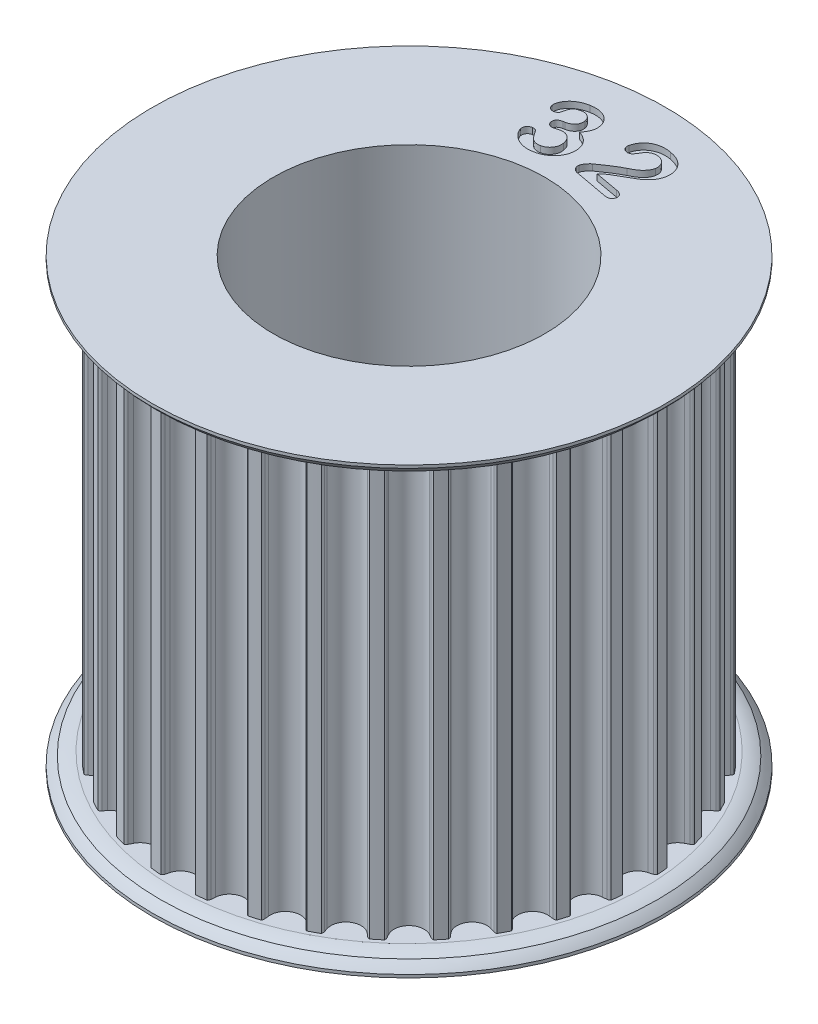
from build123d import *

# Parameters (mm, degrees)
SKETCH1_R                    = 14.897875026
TOOTHOD_DEPTH                = 13.335
TOOTHPROFILE_DEPTH           = 25.934225185
TOOTHPATTERN_COUNT           = 32
BORE_DEPTH                   = 28.373214211
BORE_DEPTH_BACK              = 28.373214211
SKETCH7_R                    = 8.73125
LARGE_TOOTH_COUNT_DEPTH      = 37.901095173
LARGE_TOOTH_COUNT_DEPTH_BACK = 0.4
SKETCH14_W                   = 12.7
SKETCH14_H                   = 2.8829


with BuildPart() as part:
    # Sketch1 → ToothOD (new, symmetric)
    with BuildSketch(Plane(origin=(0, 0, 0), x_dir=(1, 0, 0), z_dir=(0, 1, 0))):
        Circle(SKETCH1_R)
    extrude(amount=TOOTHOD_DEPTH, both=True)

    # Sketch2 → ToothProfile (cut, symmetric)
    with BuildSketch(Plane(origin=(0, 0, 0), x_dir=(1, 0, 0), z_dir=(0, 1, 0))):
        with BuildLine():
            ThreePointArc((-0.937033068, 14.447937022), (-0.590385173, 13.929762412), (0, 13.729475026))
            ThreePointArc((0, 13.729475026), (0.590385173, 13.929762412), (0.937033068, 14.447937022))
            ThreePointArc((0.937033068, 14.447937022), (0.971699064, 14.574048484), (1.007805813, 14.699755026))
            ThreePointArc((1.007805813, 14.699755026), (1.049505061, 14.78673532), (1.11667299, 14.855965863))
            ThreePointArc((1.11667299, 14.855965863), (0, 14.897875026), (-1.11667299, 14.855965863))
            ThreePointArc((-1.11667299, 14.855965863), (-1.049505061, 14.78673532), (-1.007805813, 14.699755026))
            ThreePointArc((-1.007805813, 14.699755026), (-0.971699064, 14.574048484), (-0.937033068, 14.447937022))
        make_face()
    toothprofile = extrude(amount=TOOTHPROFILE_DEPTH, both=True, mode=Mode.SUBTRACT)

    # ToothPattern: ToothProfile ×32 about axis
    toothpattern_axis = Axis((0, 13.335, 0), (0, -1, 0))
    for i in range(1, TOOTHPATTERN_COUNT):
        add(toothprofile.rotate(toothpattern_axis, i * 360 / TOOTHPATTERN_COUNT), mode=Mode.SUBTRACT)

    # Sketch4 → Flange (revolve)
    with BuildSketch(Plane.XY):
        with BuildLine():
            Line((0, -13.335), (15.151875026, -13.335))
            ThreePointArc((15.151875026, -13.335), (15.588054604, -13.424791667), (16.002, -13.589))
            ThreePointArc((16.002, -13.589), (16.270284982, -13.828715018), (16.51, -14.097))
            Line((16.51, -14.097), (16.51, -14.2875))
            Line((16.51, -14.2875), (0, -14.2875))
            Line((0, -14.2875), (0, -13.335))
        make_face()
        with BuildLine():
            Line((16.51, 14.2875), (16.51, 14.097))
            ThreePointArc((16.51, 14.097), (16.270284982, 13.828715018), (16.002, 13.589))
            ThreePointArc((16.002, 13.589), (15.588054604, 13.424791667), (15.151875026, 13.335))
            Line((15.151875026, 13.335), (0, 13.335))
            Line((0, 13.335), (0, 14.2875))
            Line((0, 14.2875), (16.51, 14.2875))
        make_face()
    revolve(axis=Axis((0, 8.73125, 0), (0, -1, 0)))

    # Sketch7 → Bore (cut, two sides: drawn at the far end of the back side and taken through both)
    with BuildSketch(Plane.XZ.offset(-BORE_DEPTH_BACK)):
        Circle(SKETCH7_R)
    extrude(amount=BORE_DEPTH + BORE_DEPTH_BACK, mode=Mode.SUBTRACT)

    # Sketch9 → Large Tooth Count (cut, two sides: drawn at the far end of the back side and taken through both)
    with BuildSketch(Plane(origin=(0, 14.2875, 0), x_dir=(1, 0, 0), z_dir=(0, 1, 0)).offset(-LARGE_TOOTH_COUNT_DEPTH_BACK)):
        with BuildLine():
            add(Edge.make_bspline(
                [(-2.395395166, 12.44030561), (-2.351764935, 12.449788273), (-2.26636482, 12.468349267), (-2.148342517, 12.521687794), (-2.042804555, 12.591006059), (-1.96740896, 12.663473497), (-1.915871931, 12.728738206), (-1.883660529, 12.781439315), (-1.858242003, 12.837454575), (-1.840411306, 12.896637263), (-1.829894588, 12.959037271), (-1.825356933, 13.024243133), (-1.828016507, 13.092828085), (-1.835316428, 13.138960651), (-1.839075635, 13.162717329)],
                knots=[0, 0, 0, 0, 1.56408417, 3.061477405, 4.516692484, 5.980328475, 6.71001621, 7.432406507, 8.143441474, 8.864242186, 9.596246751, 10.361021371, 11.155982632, 12, 12, 12, 12], degree=3))
            add(Edge.make_bspline(
                [(-1.839075635, 13.162717329), (-1.847468614, 13.198321462), (-1.863918276, 13.268103117), (-1.912945679, 13.363762957), (-1.979770738, 13.4477246), (-2.063508364, 13.518748482), (-2.161688264, 13.573950381), (-2.272366388, 13.606154076), (-2.39306776, 13.616531188), (-2.474963903, 13.604676737), (-2.517731885, 13.598486079)],
                knots=[0, 0, 0, 0, 0.970242947, 1.901609501, 2.831594879, 3.809017159, 4.805027202, 5.804681963, 6.853556249, 8, 8, 8, 8], degree=3))
            add(Edge.make_bspline(
                [(-2.517731885, 13.598486079), (-2.546415601, 13.592694971), (-2.601323677, 13.581609287), (-2.678208847, 13.55850786), (-2.746350603, 13.530836409), (-2.805384858, 13.497992457), (-2.855844248, 13.460479936), (-2.900373354, 13.421487835), (-2.937064484, 13.378096327), (-2.978986878, 13.315102944), (-3.020518734, 13.221832551), (-3.059478235, 13.098283973), (-3.093381877, 12.968046045), (-3.114639047, 12.880861708), (-3.124950635, 12.838569673)],
                knots=[0, 0, 0, 0, 0.994372717, 1.903487376, 2.72466848, 3.490292993, 4.192582868, 4.858964158, 5.497730828, 6.117954991, 7.426137334, 8.949273991, 10.520130824, 12, 12, 12, 12], degree=3))
            add(Edge.make_bspline(
                [(-3.124950635, 12.838569673), (-3.129102288, 12.828888525), (-3.137555782, 12.809176013), (-3.156946896, 12.781271911), (-3.184316211, 12.757087617), (-3.228365663, 12.724989234), (-3.296869514, 12.693279737), (-3.356792915, 12.679657358), (-3.388376416, 12.672477485)],
                knots=[0, 0, 0, 0, 0.583215557, 1.187529019, 1.864732099, 2.597558886, 4.206693834, 6, 6, 6, 6], degree=3))
            add(Edge.make_bspline(
                [(-3.388376416, 12.672477485), (-3.408006408, 12.670159859), (-3.447059185, 12.665549071), (-3.507022694, 12.67355228), (-3.566425146, 12.693523488), (-3.623655514, 12.725811297), (-3.677136394, 12.767570228), (-3.718303855, 12.823277744), (-3.750834042, 12.887407726), (-3.76148388, 12.935253341), (-3.766995166, 12.960013423)],
                knots=[0, 0, 0, 0, 0.895545026, 1.78163704, 2.722927117, 3.728259503, 4.757347425, 5.780279766, 6.851295854, 8, 8, 8, 8], degree=3))
            add(Edge.make_bspline(
                [(-3.766995166, 12.960013423), (-3.770411448, 12.985862618), (-3.777384046, 13.038620566), (-3.773919219, 13.121047331), (-3.759263587, 13.207335205), (-3.733005125, 13.296987906), (-3.696578666, 13.389099655), (-3.647932397, 13.480993304), (-3.588113382, 13.572735702), (-3.518084365, 13.664428947), (-3.436036471, 13.753650839), (-3.341843972, 13.838087605), (-3.234599648, 13.915677391), (-3.115927699, 13.987966339), (-2.986130398, 14.052791424), (-2.845920922, 14.108605922), (-2.695743201, 14.153101315), (-2.591436102, 14.174340706), (-2.538270166, 14.185166548)],
                knots=[0, 0, 0, 0, 0.657648442, 1.342253878, 2.074039585, 2.864148476, 3.697712609, 4.572156031, 5.485651204, 6.461680898, 7.483386968, 8.543039874, 9.651430748, 10.822328438, 12.049685541, 13.311901225, 14.629860395, 16, 16, 16, 16], degree=3))
            add(Edge.make_bspline(
                [(-2.538270166, 14.185166548), (-2.491323817, 14.192598445), (-2.399252753, 14.207173862), (-2.262542202, 14.218659249), (-2.130523977, 14.21615243), (-2.003510296, 14.205171913), (-1.88150585, 14.182798989), (-1.765492151, 14.149880101), (-1.655706619, 14.106812961), (-1.552939002, 14.053959346), (-1.457386459, 13.992879421), (-1.37142964, 13.922784448), (-1.294282136, 13.845573559), (-1.228614102, 13.759473777), (-1.172184525, 13.667230001), (-1.12544845, 13.569517), (-1.089148427, 13.465869789), (-1.073635459, 13.393899723), (-1.065764698, 13.357384517)],
                knots=[0, 0, 0, 0, 1.205963252, 2.365132143, 3.475536425, 4.552557823, 5.596986774, 6.617881568, 7.608112011, 8.584359298, 9.54600503, 10.480268389, 11.393565618, 12.30907766, 13.221030907, 14.133203077, 15.052849641, 16, 16, 16, 16], degree=3))
            add(Edge.make_bspline(
                [(-1.065764698, 13.357384517), (-1.058444517, 13.309874096), (-1.044223716, 13.217576343), (-1.046060272, 13.080838704), (-1.062999475, 12.95140843), (-1.100190083, 12.829006806), (-1.152753369, 12.710344301), (-1.218197892, 12.591451706), (-1.297956271, 12.471597027), (-1.359266437, 12.394328645), (-1.390805323, 12.35458061)],
                knots=[0, 0, 0, 0, 1.053632123, 2.04687467, 2.990381272, 3.91042597, 4.843946409, 5.835317206, 6.886454128, 8, 8, 8, 8], degree=3))
            add(Edge.make_bspline(
                [(-1.390805323, 12.35458061), (-1.350412041, 12.340545314), (-1.270980886, 12.312945681), (-1.157752588, 12.262979632), (-1.052586502, 12.206626181), (-0.956144809, 12.143795096), (-0.867013097, 12.07655175), (-0.788401054, 12.001417094), (-0.716721652, 11.921931915), (-0.655517404, 11.83490394), (-0.602231291, 11.742811281), (-0.559592513, 11.644667954), (-0.524881708, 11.541361692), (-0.509910371, 11.46953943), (-0.502301416, 11.43303686)],
                knots=[0, 0, 0, 0, 1.139891914, 2.24153439, 3.296229475, 4.31773043, 5.308329865, 6.268443975, 7.212979858, 8.157782482, 9.099914282, 10.045216846, 11.006511264, 12, 12, 12, 12], degree=3))
            add(Edge.make_bspline(
                [(-0.502301416, 11.43303686), (-0.495319451, 11.388490119), (-0.481414307, 11.299771707), (-0.478916202, 11.164667165), (-0.488260491, 11.029415833), (-0.51276627, 10.894860542), (-0.549846959, 10.762327063), (-0.602249742, 10.634138329), (-0.667869204, 10.510393731), (-0.746222597, 10.391484268), (-0.838347041, 10.280067973), (-0.942787724, 10.17663575), (-1.059215889, 10.081986318), (-1.186989884, 9.996266633), (-1.325681923, 9.920701304), (-1.475651654, 9.858916788), (-1.635068246, 9.806633217), (-1.746512528, 9.78436586), (-1.803356885, 9.773007954)],
                knots=[0, 0, 0, 0, 0.919196757, 1.830654129, 2.750292315, 3.682047259, 4.616530511, 5.553871909, 6.502170786, 7.470871317, 8.454707972, 9.446890999, 10.465768377, 11.511964047, 12.582837701, 13.682741819, 14.818036711, 16, 16, 16, 16], degree=3))
            add(Edge.make_bspline(
                [(-1.803356885, 9.773007954), (-1.861273881, 9.764095157), (-1.97457734, 9.746658985), (-2.143413115, 9.740832432), (-2.305966452, 9.751048954), (-2.461225746, 9.778889999), (-2.606979598, 9.821119725), (-2.742928406, 9.873090337), (-2.868308727, 9.934276457), (-2.981900004, 10.005903776), (-3.083286845, 10.085279788), (-3.175837052, 10.166704637), (-3.256567319, 10.253286516), (-3.326556915, 10.341337364), (-3.383639504, 10.428572924), (-3.428783069, 10.510279282), (-3.462785872, 10.585170072), (-3.474766814, 10.634802087), (-3.480352198, 10.657939985)],
                knots=[0, 0, 0, 0, 1.358988971, 2.658600414, 3.911700577, 5.132627013, 6.311151581, 7.428568411, 8.506776026, 9.543649576, 10.538503265, 11.492538343, 12.401569204, 13.281931069, 14.10006001, 14.817332809, 15.448653585, 16, 16, 16, 16], degree=3))
            add(Edge.make_bspline(
                [(-3.480352198, 10.657939985), (-3.483746984, 10.68497257), (-3.490277506, 10.736974917), (-3.483346924, 10.814189742), (-3.459407148, 10.885488216), (-3.420429227, 10.949801807), (-3.370073369, 11.006058136), (-3.308307685, 11.050542415), (-3.238271172, 11.084475844), (-3.186891971, 11.095909843), (-3.160669385, 11.101745454)],
                knots=[0, 0, 0, 0, 1.065165672, 2.049049875, 3.00773798, 3.985592617, 4.976224793, 5.944087156, 6.950716419, 8, 8, 8, 8], degree=3))
            add(Edge.make_bspline(
                [(-3.160669385, 11.101745454), (-3.132597094, 11.104682386), (-3.07565053, 11.110640153), (-3.005449066, 11.091014031), (-2.953679925, 11.068571016), (-2.91939304, 11.047595496), (-2.891337116, 11.023070197), (-2.877833025, 11.003226451), (-2.87134751, 10.993696235)],
                knots=[0, 0, 0, 0, 1.550673656, 3.145647615, 3.957272918, 4.675311549, 5.363801208, 6, 6, 6, 6], degree=3))
            add(Edge.make_bspline(
                [(-2.87134751, 10.993696235), (-2.834765451, 10.934439869), (-2.765769991, 10.822679615), (-2.654254449, 10.673931939), (-2.546873402, 10.549804547), (-2.454600564, 10.465849729), (-2.379391167, 10.412984746), (-2.320630434, 10.38270277), (-2.259082437, 10.358414541), (-2.19377006, 10.341195919), (-2.12514281, 10.331648111), (-2.053345183, 10.329022341), (-1.978350806, 10.333749213), (-1.927728345, 10.341432664), (-1.901583448, 10.345400923)],
                knots=[0, 0, 0, 0, 1.989651524, 3.75257504, 5.30775678, 6.675689646, 7.305821198, 7.929950262, 8.560368956, 9.193937615, 9.855728221, 10.536870827, 11.244340126, 12, 12, 12, 12], degree=3))
            add(Edge.make_bspline(
                [(-1.901583448, 10.345400923), (-1.871644399, 10.352199583), (-1.811653801, 10.36582245), (-1.724531025, 10.397969414), (-1.641916359, 10.442636299), (-1.563158271, 10.496780316), (-1.491100009, 10.561890428), (-1.427079449, 10.636365346), (-1.373201458, 10.72071369), (-1.328532708, 10.813025229), (-1.296080307, 10.912955075), (-1.279366413, 11.018302819), (-1.277092498, 11.127852865), (-1.287926429, 11.200953457), (-1.293471729, 11.238369673)],
                knots=[0, 0, 0, 0, 0.918783497, 1.841019456, 2.770121856, 3.724533536, 4.696473957, 5.670047891, 6.656552307, 7.685126467, 8.733743146, 9.79028542, 10.868967352, 12, 12, 12, 12], degree=3))
            add(Edge.make_bspline(
                [(-1.293471729, 11.238369673), (-1.298936686, 11.265876176), (-1.30961674, 11.319631579), (-1.333478309, 11.396401406), (-1.360287624, 11.468479114), (-1.394965812, 11.533732243), (-1.433076599, 11.593785038), (-1.476357011, 11.648422925), (-1.525805682, 11.69629192), (-1.579318811, 11.739547501), (-1.637253652, 11.775881164), (-1.698731759, 11.806115638), (-1.76434029, 11.827990482), (-1.83303783, 11.844288015), (-1.905487999, 11.853175874), (-1.98114044, 11.854782163), (-2.060573072, 11.849194939), (-2.114159971, 11.840923764), (-2.141792041, 11.836658735)],
                knots=[0, 0, 0, 0, 1.142167213, 2.232114242, 3.272952444, 4.271354239, 5.237162538, 6.16931723, 7.104388237, 8.036542928, 8.968855492, 9.885808178, 10.82190168, 11.781211808, 12.759285311, 13.790748962, 14.860800298, 16, 16, 16, 16], degree=3))
            add(Edge.make_bspline(
                [(-2.141792041, 11.836658735), (-2.152794304, 11.834231238), (-2.177762529, 11.828722342), (-2.219583134, 11.820746399), (-2.268450918, 11.806036359), (-2.322602613, 11.792515486), (-2.374969303, 11.777315582), (-2.420194021, 11.766479519), (-2.454197188, 11.756940782), (-2.473367184, 11.752663579), (-2.481120166, 11.750933735)],
                knots=[0, 0, 0, 0, 0.772488785, 1.753064323, 2.916415325, 4.267721891, 5.579625089, 6.653636691, 7.455485957, 8, 8, 8, 8], degree=3))
            add(Edge.make_bspline(
                [(-2.481120166, 11.750933735), (-2.506960456, 11.746913438), (-2.556158075, 11.739259148), (-2.627480161, 11.7445519), (-2.692385424, 11.758886393), (-2.748894318, 11.788116673), (-2.797532533, 11.827971419), (-2.835684342, 11.879578873), (-2.863495022, 11.941556302), (-2.873931957, 11.987031385), (-2.879384229, 12.010787642)],
                knots=[0, 0, 0, 0, 1.158395447, 2.205482207, 3.158342672, 4.093034092, 5.004217035, 5.930162721, 6.91871368, 8, 8, 8, 8], degree=3))
            add(Edge.make_bspline(
                [(-2.879384229, 12.010787642), (-2.882631581, 12.034581517), (-2.888938576, 12.080793902), (-2.878805561, 12.149340934), (-2.856720158, 12.213565122), (-2.817758689, 12.271771874), (-2.764205594, 12.323365118), (-2.69486753, 12.365228304), (-2.61067647, 12.39742537), (-2.548927529, 12.410824563), (-2.515945948, 12.417981392)],
                knots=[0, 0, 0, 0, 0.930670598, 1.807545321, 2.668967297, 3.556120476, 4.506850782, 5.542439393, 6.687358266, 8, 8, 8, 8], degree=3))
            Line((-2.515945948, 12.417981392), (-2.395395166, 12.44030561))
        make_face()
        with BuildLine():
            Line((1.496615625, 10.596661719), (3.040558594, 10.315376563))
            add(Edge.make_bspline(
                [(3.040558594, 10.315376563), (3.076470418, 10.307529852), (3.14431808, 10.29270518), (3.237910492, 10.259647673), (3.314810362, 10.214619672), (3.376258953, 10.161565269), (3.421206567, 10.100520807), (3.450051698, 10.033069352), (3.459924706, 9.959095721), (3.453664837, 9.90962643), (3.45043125, 9.884072656)],
                knots=[0, 0, 0, 0, 1.314385246, 2.483248006, 3.533178983, 4.483663627, 5.367405748, 6.221602073, 7.081353774, 8, 8, 8, 8], degree=3))
            add(Edge.make_bspline(
                [(3.45043125, 9.884072656), (3.444961292, 9.861219289), (3.434340382, 9.816845352), (3.405482322, 9.754899622), (3.362843684, 9.703056412), (3.312211901, 9.657228683), (3.249546097, 9.623838458), (3.176296577, 9.605064484), (3.093496604, 9.601079944), (3.036016191, 9.609216438), (3.005732812, 9.613503125)],
                knots=[0, 0, 0, 0, 0.959057919, 1.862184029, 2.762603093, 3.684857112, 4.637180914, 5.631458474, 6.752141176, 8, 8, 8, 8], degree=3))
            Line((3.005732812, 9.613503125), (0.834032812, 10.008195313))
            add(Edge.make_bspline(
                [(0.834032812, 10.008195313), (0.799163966, 10.01595986), (0.732766902, 10.030745068), (0.642318567, 10.070362747), (0.567285441, 10.124046885), (0.507994511, 10.189554013), (0.465616838, 10.262800945), (0.437487267, 10.339157189), (0.427085453, 10.418934404), (0.433438937, 10.471680098), (0.436661719, 10.498435156)],
                knots=[0, 0, 0, 0, 1.213696302, 2.311113739, 3.33440628, 4.331286816, 5.293760978, 6.197287054, 7.085580533, 8, 8, 8, 8], degree=3))
            add(Edge.make_bspline(
                [(0.436661719, 10.498435156), (0.44113245, 10.517092061), (0.450927104, 10.55796634), (0.480593947, 10.619569477), (0.517946299, 10.689367879), (0.566975791, 10.762212902), (0.620934828, 10.834331531), (0.676255614, 10.900345371), (0.732255923, 10.956275524), (0.77210726, 10.987251868), (0.791170312, 11.002069531)],
                knots=[0, 0, 0, 0, 0.73413026, 1.608361423, 2.609947524, 3.772309139, 4.971338235, 6.065032966, 7.074400508, 8, 8, 8, 8], degree=3))
            add(Edge.make_bspline(
                [(0.791170312, 11.002069531), (0.866962318, 11.055506875), (1.013806864, 11.159039993), (1.228848625, 11.306818186), (1.432353271, 11.440362051), (1.593594202, 11.543173644), (1.71386318, 11.618765143), (1.795973475, 11.668863223), (1.871533756, 11.713095185), (1.939959813, 11.752742621), (2.001297798, 11.787792166), (2.056499784, 11.817040794), (2.104597411, 11.841464707), (2.134742615, 11.85495609), (2.148482812, 11.861105469)],
                knots=[0, 0, 0, 0, 2.076286751, 4.022738109, 5.841539434, 7.525706709, 8.304174298, 9.021940097, 9.679141635, 10.264386048, 10.792591321, 11.260659723, 11.663008358, 12, 12, 12, 12], degree=3))
            add(Edge.make_bspline(
                [(2.148482812, 11.861105469), (2.192706975, 11.882190765), (2.278406252, 11.923050661), (2.400603528, 11.988337279), (2.512124748, 12.055970048), (2.613831073, 12.126012776), (2.705978014, 12.198152933), (2.788926098, 12.273162333), (2.860996139, 12.352152812), (2.925064114, 12.432473328), (2.978920615, 12.515058351), (3.020703701, 12.599886896), (3.054371063, 12.684681647), (3.066652771, 12.743129295), (3.072705469, 12.771933594)],
                knots=[0, 0, 0, 0, 1.309285269, 2.537183194, 3.700941637, 4.793226826, 5.835618559, 6.826659668, 7.778117931, 8.690044814, 9.570477442, 10.40652055, 11.214697947, 12, 12, 12, 12], degree=3))
            add(Edge.make_bspline(
                [(3.072705469, 12.771933594), (3.077045195, 12.802517658), (3.08557015, 12.862596973), (3.085032021, 12.952655893), (3.06992249, 13.039653397), (3.044465016, 13.123287094), (3.007335811, 13.201844988), (2.961999685, 13.275372781), (2.904891797, 13.340491842), (2.839619482, 13.39889567), (2.766488225, 13.448098243), (2.688362349, 13.490342001), (2.603553141, 13.520577547), (2.544530415, 13.533389685), (2.5146, 13.539886719)],
                knots=[0, 0, 0, 0, 1.048430709, 2.059536561, 3.043538049, 4.03813078, 5.019687928, 5.987453245, 6.96237482, 7.950626426, 8.954579394, 9.949583156, 10.960233954, 12, 12, 12, 12], degree=3))
            add(Edge.make_bspline(
                [(2.5146, 13.539886719), (2.482820674, 13.54448865), (2.420671914, 13.553488348), (2.327939553, 13.55436703), (2.238730534, 13.543786238), (2.152821856, 13.521121308), (2.070041803, 13.486714282), (1.99030555, 13.441126644), (1.914677836, 13.383087672), (1.868529839, 13.337981126), (1.844873437, 13.314858594)],
                knots=[0, 0, 0, 0, 1.041995574, 2.037762919, 3.001819629, 3.951470224, 4.913731895, 5.905361163, 6.926245566, 8, 8, 8, 8], degree=3))
            add(Edge.make_bspline(
                [(1.844873437, 13.314858594), (1.836962752, 13.305462185), (1.817025803, 13.281780835), (1.786604762, 13.234083654), (1.746619453, 13.16957223), (1.701353572, 13.09081871), (1.652304826, 13.008995963), (1.599262762, 12.934818624), (1.545778336, 12.87266957), (1.49317075, 12.819527194), (1.434837571, 12.779725159), (1.367500147, 12.758406911), (1.293160743, 12.751011076), (1.242068056, 12.758297723), (1.215330469, 12.762110938)],
                knots=[0, 0, 0, 0, 0.490086648, 1.23514352, 2.254462762, 3.522463602, 4.861828676, 6.062585089, 7.158452149, 8.133567385, 9.043474829, 9.94558515, 10.924893206, 12, 12, 12, 12], degree=3))
            add(Edge.make_bspline(
                [(1.215330469, 12.762110938), (1.1918008, 12.767409863), (1.145864513, 12.777754801), (1.083403861, 12.809054218), (1.029226098, 12.850852466), (0.985428581, 12.903944097), (0.952990379, 12.965964312), (0.934113845, 13.035639936), (0.928767472, 13.112079072), (0.935749543, 13.16430178), (0.939403125, 13.191628906)],
                knots=[0, 0, 0, 0, 1.005735255, 1.963467701, 2.894942414, 3.849838088, 4.818834576, 5.800546011, 6.849068571, 8, 8, 8, 8], degree=3))
            add(Edge.make_bspline(
                [(0.939403125, 13.191628906), (0.94695919, 13.226372907), (0.962245997, 13.296664108), (1.000256812, 13.400153913), (1.04856227, 13.50383482), (1.107973434, 13.60708464), (1.179327685, 13.706743847), (1.261023938, 13.800680193), (1.354522548, 13.88561604), (1.455861058, 13.964943482), (1.569265613, 14.034125276), (1.693586214, 14.091505787), (1.827880808, 14.139532123), (1.972635001, 14.174976968), (2.127793885, 14.19738943), (2.292899535, 14.204363143), (2.467541024, 14.194376892), (2.585869916, 14.175547174), (2.646759375, 14.165857813)],
                knots=[0, 0, 0, 0, 0.778623011, 1.575245933, 2.410124108, 3.284189594, 4.182255238, 5.09314751, 6.007422066, 6.94709478, 7.9105916, 8.911814582, 9.943694323, 11.032469103, 12.172997958, 13.374709305, 14.649082835, 16, 16, 16, 16], degree=3))
            add(Edge.make_bspline(
                [(2.646759375, 14.165857813), (2.719162228, 14.150908352), (2.859098956, 14.122014759), (3.056086837, 14.056987574), (3.234831122, 13.97904578), (3.340195258, 13.910703589), (3.391495312, 13.877428906)],
                knots=[0, 0, 0, 0, 1.10182767, 2.12955916, 3.089313288, 4, 4, 4, 4], degree=3))
            add(Edge.make_bspline(
                [(3.391495312, 13.877428906), (3.422130205, 13.854896901), (3.482988067, 13.810135862), (3.563994851, 13.730952279), (3.638997687, 13.646231282), (3.704528082, 13.552931595), (3.762949243, 13.454554394), (3.810101114, 13.349741993), (3.849241088, 13.240701726), (3.87594831, 13.126759136), (3.894541231, 13.010978885), (3.900291629, 12.894319628), (3.896470494, 12.777654807), (3.884875953, 12.700716463), (3.87905625, 12.662098437)],
                knots=[0, 0, 0, 0, 0.989601704, 1.965896975, 2.944161331, 3.933975698, 4.931476062, 5.920469902, 6.923591216, 7.944892093, 8.964867275, 9.974442286, 10.983302259, 12, 12, 12, 12], degree=3))
            add(Edge.make_bspline(
                [(3.87905625, 12.662098437), (3.866169811, 12.602664581), (3.840777325, 12.48555128), (3.773651638, 12.320167998), (3.688108563, 12.165898311), (3.579162293, 12.029559915), (3.463688662, 11.90680358), (3.348390019, 11.798394421), (3.235730394, 11.705184883), (3.13917087, 11.639342083), (3.057242007, 11.591902158), (2.989711036, 11.549852641), (2.911340993, 11.505758413), (2.824482157, 11.45595952), (2.72861257, 11.40099989), (2.623071205, 11.34260014), (2.509348807, 11.277865659), (2.38847295, 11.212015268), (2.268459364, 11.145361649), (2.155554631, 11.079785794), (2.052040051, 11.018057588), (1.957177451, 10.960936398), (1.873570422, 10.904701617), (1.797934742, 10.854509569), (1.733071528, 10.806322664), (1.693584005, 10.774761348), (1.675209375, 10.760075)],
                knots=[0, 0, 0, 0, 1.453984622, 2.865049479, 4.256733719, 5.664048518, 7.030772165, 8.291537635, 9.451615229, 10.529147169, 11.085384378, 11.718642237, 12.433929054, 13.238513743, 14.116484075, 15.080257941, 16.127126092, 17.250147251, 18.376624458, 19.414645574, 20.376757237, 21.263108444, 22.065796271, 22.789417081, 23.436682463, 24, 24, 24, 24], degree=3))
            add(Edge.make_bspline(
                [(1.675209375, 10.760075), (1.645896999, 10.736150025), (1.583293421, 10.685052527), (1.526707024, 10.627347813), (1.496615625, 10.596661719)],
                knots=[0, 0, 0, 0, 0.936444089, 2, 2, 2, 2], degree=3))
        make_face()
    extrude(amount=LARGE_TOOTH_COUNT_DEPTH + LARGE_TOOTH_COUNT_DEPTH_BACK, mode=Mode.SUBTRACT)

    # Sketch14 → Cut-Revolve1 (revolve, cut)
    with BuildSketch(Plane.XY):
        with Locations((6.35, -12.84605)):
            Rectangle(SKETCH14_W, SKETCH14_H)
    revolve(axis=Axis((0, 0, 0), (0, 1, 0)), mode=Mode.SUBTRACT)


solid = part.part
